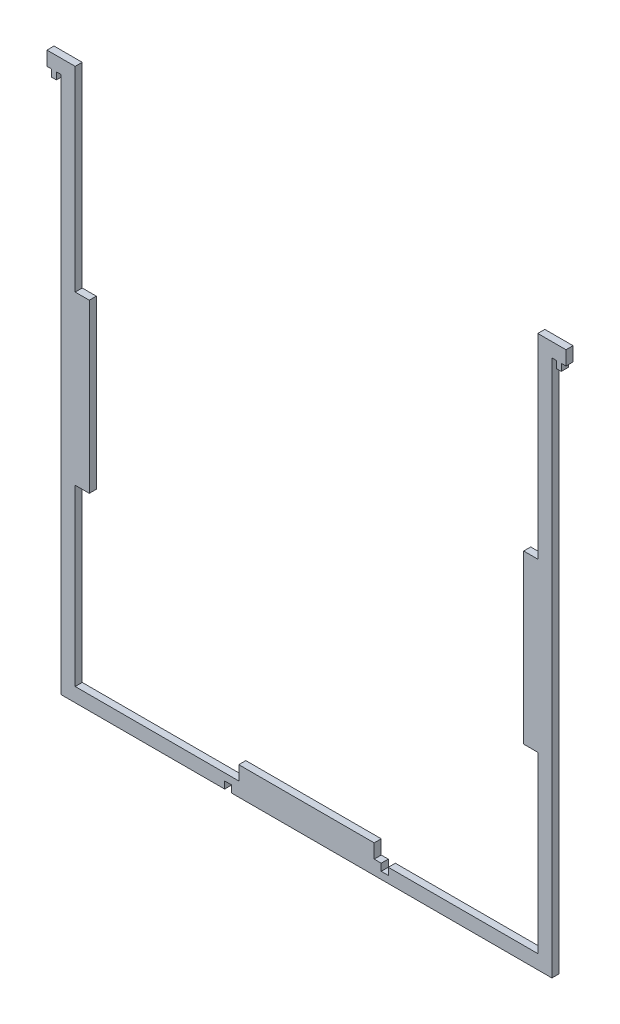
from build123d import *

# Parameters (mm, degrees)
BOSS_EXTRUDE1_DEPTH = 3.175
MIRROR1_OUTLINE_W   = 6.35
MIRROR1_OUTLINE_H   = 3.175
MIRROR1_DEPTH       = 248.225
MIRROR1_2_OUTLINE_W = 104.175
MIRROR1_2_OUTLINE_H = 3.175
MIRROR1_2_DEPTH     = 6.35
MIRROR1_START       = 84.858333333
MIRROR1_3_OUTLINE_W = 6.35
MIRROR1_3_OUTLINE_H = 3.175
MIRROR1_3_DEPTH     = 75.333333334
MIRROR1_START_2     = 6.35
MIRROR1_4_OUTLINE_W = 30.491666667
MIRROR1_4_OUTLINE_H = 3.175
MIRROR1_4_DEPTH     = 6.35
MIRROR1_START_3     = 241.875
MIRROR1_5_OUTLINE_W = 6.35
MIRROR1_5_OUTLINE_H = 3.175
MIRROR1_5_DEPTH     = 6.35
MIRROR1_START_4     = 238.7
MIRROR1_6_OUTLINE_W = 2.116666666
MIRROR1_6_OUTLINE_H = 3.175
MIRROR1_6_DEPTH     = 3.175
SKETCH2_W           = 3.175
SKETCH2_H           = 3.175
CUT_EXTRUDE1_DEPTH  = 3.175


# Read off the part's stored shape, not the designer's step: Mirror1
with BuildPart() as part:
    # Sketch1 → Boss-Extrude1 (new body)
    with BuildSketch(Plane.XY):
        Polygon((6.35, 232.35), (0, 232.35), (0, 0), (110.525, 0), (110.525, 12.7), (80.033333333, 12.7), (80.033333333, 6.35), (6.35, 6.35), (6.35, 84.858333333), (12.7, 84.858333333), (12.7, 160.191666667), (6.35, 160.191666667), align=None)
        Polygon((-2.116666667, 241.875), (0, 241.875), (0, 232.35), (6.35, 232.35), (6.35, 248.225), (-6.35, 248.225), (-6.35, 241.875), (-4.233333333, 241.875), (-4.233333333, 238.7), (-2.116666667, 238.7), align=None)
    extrude(amount=BOSS_EXTRUDE1_DEPTH)



with BuildPart() as body_2:
    # Mirror1 outline → Mirror1 (new body)
    with BuildSketch(Plane(origin=(0, 0, 0), x_dir=(1, 0, 0), z_dir=(0, 1, 0))):
        with Locations((217.875, -1.5875)):
            Rectangle(MIRROR1_OUTLINE_W, MIRROR1_OUTLINE_H)
    extrude(amount=MIRROR1_DEPTH)


with BuildPart() as part_1:
    add(part.part)

    add(body_2.part)  # Mirror1 2 merges body 2
    # Mirror1 2 outline → Mirror1 2 (add)
    with BuildSketch(Plane(origin=(0, 0, 0), x_dir=(1, 0, 0), z_dir=(0, 1, 0))):
        with Locations((162.6125, -1.5875)):
            Rectangle(MIRROR1_2_OUTLINE_W, MIRROR1_2_OUTLINE_H)
    extrude(amount=MIRROR1_2_DEPTH)

    # Mirror1 3 outline → Mirror1 3 (add)
    with BuildSketch(Plane(origin=(0, 0, 0), x_dir=(1, 0, 0), z_dir=(0, 1, 0)).offset(MIRROR1_START)):
        with Locations((211.525, -1.5875)):
            Rectangle(MIRROR1_3_OUTLINE_W, MIRROR1_3_OUTLINE_H)
    extrude(amount=MIRROR1_3_DEPTH)

    # Mirror1 4 outline → Mirror1 4 (add)
    with BuildSketch(Plane(origin=(0, 0, 0), x_dir=(1, 0, 0), z_dir=(0, 1, 0)).offset(MIRROR1_START_2)):
        with Locations((125.770833334, -1.5875)):
            Rectangle(MIRROR1_4_OUTLINE_W, MIRROR1_4_OUTLINE_H)
    extrude(amount=MIRROR1_4_DEPTH)

    # Mirror1 5 outline → Mirror1 5 (add)
    with BuildSketch(Plane(origin=(0, 0, 0), x_dir=(1, 0, 0), z_dir=(0, 1, 0)).offset(MIRROR1_START_3)):
        with Locations((224.225, -1.5875)):
            Rectangle(MIRROR1_5_OUTLINE_W, MIRROR1_5_OUTLINE_H)
    extrude(amount=MIRROR1_5_DEPTH)

    # Mirror1 6 outline → Mirror1 6 (add)
    with BuildSketch(Plane(origin=(0, 0, 0), x_dir=(1, 0, 0), z_dir=(0, 1, 0)).offset(MIRROR1_START_4)):
        with Locations((224.225, -1.5875)):
            Rectangle(MIRROR1_6_OUTLINE_W, MIRROR1_6_OUTLINE_H)
    extrude(amount=MIRROR1_6_DEPTH)

    # Sketch2 → Cut-Extrude1 (cut)
    with BuildSketch(Plane.XY.offset(3.175)):
        with Locations((75.270833333, 1.5875)):
            Rectangle(SKETCH2_W, SKETCH2_H)
        with Locations((145.779166667, 4.7625)):
            Rectangle(SKETCH2_W, SKETCH2_H)
    extrude(amount=-CUT_EXTRUDE1_DEPTH, mode=Mode.SUBTRACT)


solid = part_1.part
